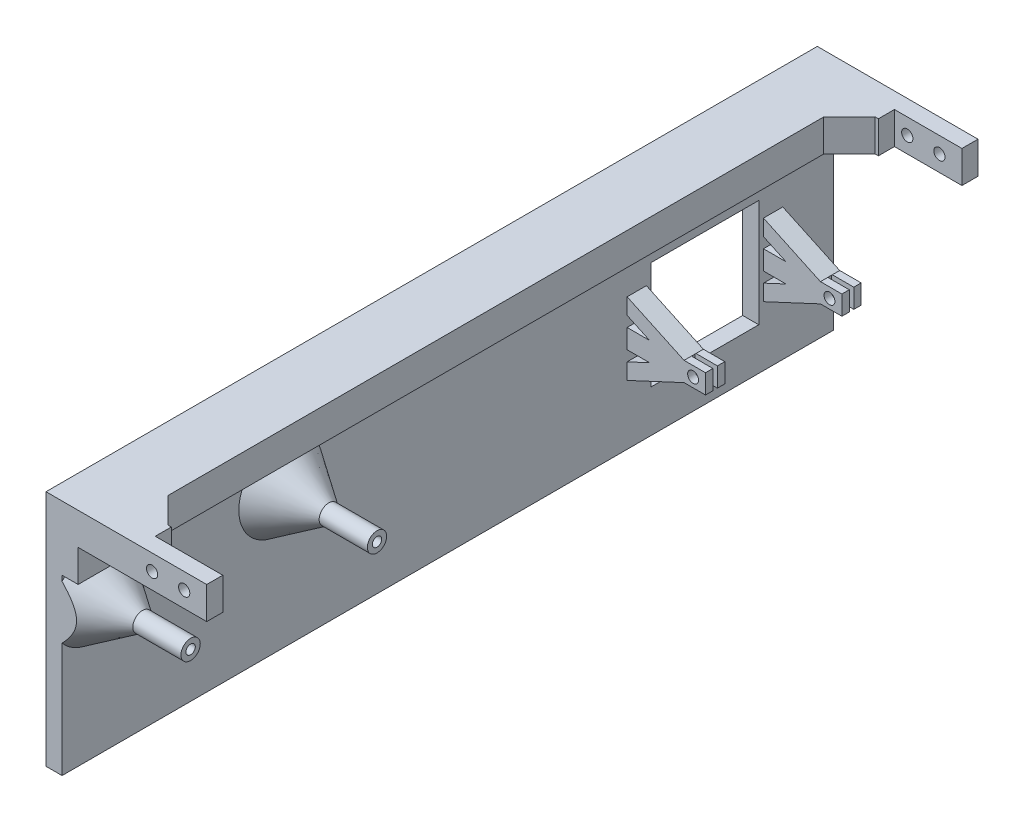
from build123d import *

# Parameters (mm, degrees)
BOSS_EXTRUDE1_DEPTH     = 240
BOSS_EXTRUDE3_DEPTH     = 10
SKETCH5_R               = 1.75
CUT_EXTRUDE1_DEPTH      = 245.131112315
SKETCH6_W               = 7
SKETCH6_H               = 12
CUT_EXTRUDE2_DEPTH      = 21
SKETCH7_W               = 5
SKETCH7_H               = 240
BOSS_EXTRUDE4_DEPTH     = 54
SKETCH8_W               = 6
SKETCH8_H               = 6
BOSS_EXTRUDE5_DEPTH     = 24.4
CUT_EXTRUDE3_DEPTH      = 229.361692278
CUT_EXTRUDE3_DEPTH_BACK = 229.361692278
SKETCH9_R               = 1.7
SKETCH10_W              = 1.4
SKETCH10_H              = 6
CUT_EXTRUDE4_DEPTH      = 7
BOSS_EXTRUDE6_REACH     = 190.225
BOSS_EXTRUDE7_DEPTH     = 6
SKETCH13_R              = 3
BOSS_EXTRUDE8_DEPTH     = 30
SKETCH15_R              = 1.45
CUT_EXTRUDE5_DEPTH      = 5
SKETCH16_W              = 33.5
SKETCH16_H              = 33.5
CUT_EXTRUDE6_DEPTH      = 5
CHAMFER1_SIZE           = 10
CHAMFER1_SIZE_2         = 15


with BuildPart() as part:
    # Sketch1 → Boss-Extrude1 (new body)
    with BuildSketch(Plane.XY):
        Polygon((-10, 0), (0, 0), (0, 10), (10, 10), (10, 20), (-10, 20), align=None)
    extrude(amount=BOSS_EXTRUDE1_DEPTH)

    # Sketch4 → Boss-Extrude3 (add)
    with BuildSketch(Plane(origin=(0, 20, 0), x_dir=(1, 0, 0), z_dir=(0, 1, 0))):
        Polygon((10, 0), (40, 0), (40, -10), (18, -10), (10, -18), align=None)
    boss_extrude3 = extrude(amount=-BOSS_EXTRUDE3_DEPTH)

    # Sketch5 → Cut-Extrude1 (cut, through all)
    with BuildSketch(Plane(origin=(0, 0, 0), x_dir=(-1, 0, 0), z_dir=(0, 0, -1))):
        with Locations((-33, 15)):
            Circle(SKETCH5_R)
        with Locations((-23, 15)):
            Circle(SKETCH5_R)
    cut_extrude1 = extrude(amount=-CUT_EXTRUDE1_DEPTH, mode=Mode.SUBTRACT)

    # Sketch6 → Cut-Extrude2 (cut)
    with BuildSketch(Plane(origin=(40, 0, 0), x_dir=(0, 0, -1), z_dir=(1, 0, 0))):
        with Locations((-8.5, 15)):
            Rectangle(SKETCH6_W, SKETCH6_H)
    cut_extrude2 = extrude(amount=-CUT_EXTRUDE2_DEPTH, mode=Mode.SUBTRACT)

    # Mirror1: Boss-Extrude3, Cut-Extrude1, Cut-Extrude2 across plane
    add(boss_extrude3.mirror(Plane(origin=(0, 0, 120), x_dir=(1, 0, 0), z_dir=(0, 0, -1))))
    add(cut_extrude1.mirror(Plane(origin=(0, 0, 120), x_dir=(1, 0, 0), z_dir=(0, 0, -1))), mode=Mode.SUBTRACT)
    add(cut_extrude2.mirror(Plane(origin=(0, 0, 120), x_dir=(1, 0, 0), z_dir=(0, 0, -1))), mode=Mode.SUBTRACT)

    # Sketch7 → Boss-Extrude4 (add)
    with BuildSketch(Plane.XZ):
        with Locations((-7.5, 120)):
            Rectangle(SKETCH7_W, SKETCH7_H)
    extrude(amount=BOSS_EXTRUDE4_DEPTH)

    # Sketch8 → Boss-Extrude5 (add)
    with BuildSketch(Plane(origin=(-5, 0, 0), x_dir=(0, 0, -1), z_dir=(1, 0, 0))):
        with Locations((-18.75, -24.15)):
            Rectangle(SKETCH8_W, SKETCH8_H)
        with Locations((-61.18, -24.15)):
            Rectangle(SKETCH8_W, SKETCH8_H)
    extrude(amount=BOSS_EXTRUDE5_DEPTH)

    # Sketch9 → Cut-Extrude3 (cut, two sides: drawn at the far end of the back side and taken through both)
    with BuildSketch(Plane.XY.offset(21.75).offset(-CUT_EXTRUDE3_DEPTH_BACK)):
        with Locations((15.53, -24.25)):
            Circle(SKETCH9_R)
    extrude(amount=CUT_EXTRUDE3_DEPTH + CUT_EXTRUDE3_DEPTH_BACK, mode=Mode.SUBTRACT)

    # Sketch10 → Cut-Extrude4 (cut)
    with BuildSketch(Plane(origin=(19.4, 0, 0), x_dir=(0, 0, -1), z_dir=(1, 0, 0))):
        with Locations((-18.75, -24.15)):
            Rectangle(SKETCH10_W, SKETCH10_H)
        with Locations((-61.18, -24.15)):
            Rectangle(SKETCH10_W, SKETCH10_H)
    extrude(amount=-CUT_EXTRUDE4_DEPTH, mode=Mode.SUBTRACT)

    # Boss-Extrude6: up to this face of the body (flat: up to its plane)
    boss_extrude6_end = Plane(part.part.faces().sort_by_distance((6.649247597, -24.143388326, 58.18))[0])
    # Sketch11 → Boss-Extrude6 (add, up to the picked face)
    with BuildSketch(Plane.XY.offset(64.18), mode=Mode.PRIVATE) as boss_extrude6_sk1:
        Polygon((12.722534603, -21.15), (-5, -12.885846393), (-5, -17.885846393), (2, -21.15), align=None)
    boss_extrude6_tool1 = split(extrude(boss_extrude6_sk1.sketch, amount=-BOSS_EXTRUDE6_REACH, mode=Mode.PRIVATE), bisect_by=boss_extrude6_end, keep=Keep.BOTH, mode=Mode.PRIVATE)
    # Sketch11 → Boss-Extrude6 (add, up to the picked face)
    with BuildSketch(Plane.XY.offset(64.18), mode=Mode.PRIVATE) as boss_extrude6_sk2:
        Polygon((-5, -30.414153607), (2, -27.15), (12.722534603, -27.15), (-5, -35.414153607), align=None)
    boss_extrude6_tool2 = split(extrude(boss_extrude6_sk2.sketch, amount=-BOSS_EXTRUDE6_REACH, mode=Mode.PRIVATE), bisect_by=boss_extrude6_end, keep=Keep.BOTH, mode=Mode.PRIVATE)
    add(boss_extrude6_tool1.solids().sort_by(Axis((1.568177, -18.087209, 64.18), (0, 0, -1)))[0])
    add(boss_extrude6_tool2.solids().sort_by(Axis((1.568177, -30.212791, 64.18), (0, 0, -1)))[0])

    # Sketch12 → Boss-Extrude7 (add)
    with BuildSketch(Plane(origin=(0, 0, 15.75), x_dir=(-1, 0, 0), z_dir=(0, 0, -1))):
        Polygon((-12.722534603, -21.15), (-2, -21.15), (5, -17.885846393), (5, -12.885846393), align=None)
        Polygon((-2, -27.15), (-12.722534603, -27.15), (5, -35.414153607), (5, -30.414153607), align=None)
    extrude(amount=-BOSS_EXTRUDE7_DEPTH)

    # Sketch13 → Boss-Extrude8 (add)
    with BuildSketch(Plane(origin=(-5, 0, 0), x_dir=(0, 0, -1), z_dir=(1, 0, 0))):
        with Locations(Location((-230, -10, 0), (0, 0, 180))):
            Circle(SKETCH13_R)
        with Locations(Location((-172, -10, 0), (0, 0, 180))):
            Circle(SKETCH13_R)
    extrude(amount=BOSS_EXTRUDE8_DEPTH)

    # Sketch15 → Cut-Extrude5 (cut)
    with BuildSketch(Plane(origin=(25, 0, 0), x_dir=(0, 0, -1), z_dir=(1, 0, 0))):
        with Locations((-230, -10)):
            Circle(SKETCH15_R)
        with Locations((-172, -10)):
            Circle(SKETCH15_R)
    extrude(amount=-CUT_EXTRUDE5_DEPTH, mode=Mode.SUBTRACT)

    # Sketch16 → Cut-Extrude6 (cut)
    with BuildSketch(Plane(origin=(-5, 0, 0), x_dir=(0, 0, -1), z_dir=(1, 0, 0))):
        with Locations((-39.965, -24.15)):
            Rectangle(SKETCH16_W, SKETCH16_H)
    extrude(amount=-CUT_EXTRUDE6_DEPTH, mode=Mode.SUBTRACT)

    # Chamfer1
    # the kernel refuses this chamfer: 15, 10 mm, written as the material it adds along each edge
    with BuildSketch(Plane(origin=(-5, -10, 172), x_dir=(0, 0, 1), z_dir=(0, 1, 0))) as chamfer1_piece_1:
        Polygon((3 + CHAMFER1_SIZE, 0), (3, CHAMFER1_SIZE_2), (3, 0), align=None)
    revolve(axis=Axis((-5, -10, 172), (1, 0, 0)))
    with BuildSketch(Plane(origin=(-5, -10, 230), x_dir=(0, 0, 1), z_dir=(0, 1, 0))) as chamfer1_piece_2_section:
        Polygon((3 + CHAMFER1_SIZE, 0), (3, CHAMFER1_SIZE_2), (3, 0), align=None)
    chamfer1_piece_2 = revolve(axis=Axis((-5, -10, 230), (1, 0, 0)), mode=Mode.PRIVATE)
    chamfer1_piece_2 = split(chamfer1_piece_2, bisect_by=Plane(origin=(2.41807783, -10, 240), z_dir=(0, 0, -1)), keep=Keep.TOP, mode=Mode.PRIVATE)
    add(chamfer1_piece_2)


solid = part.part
